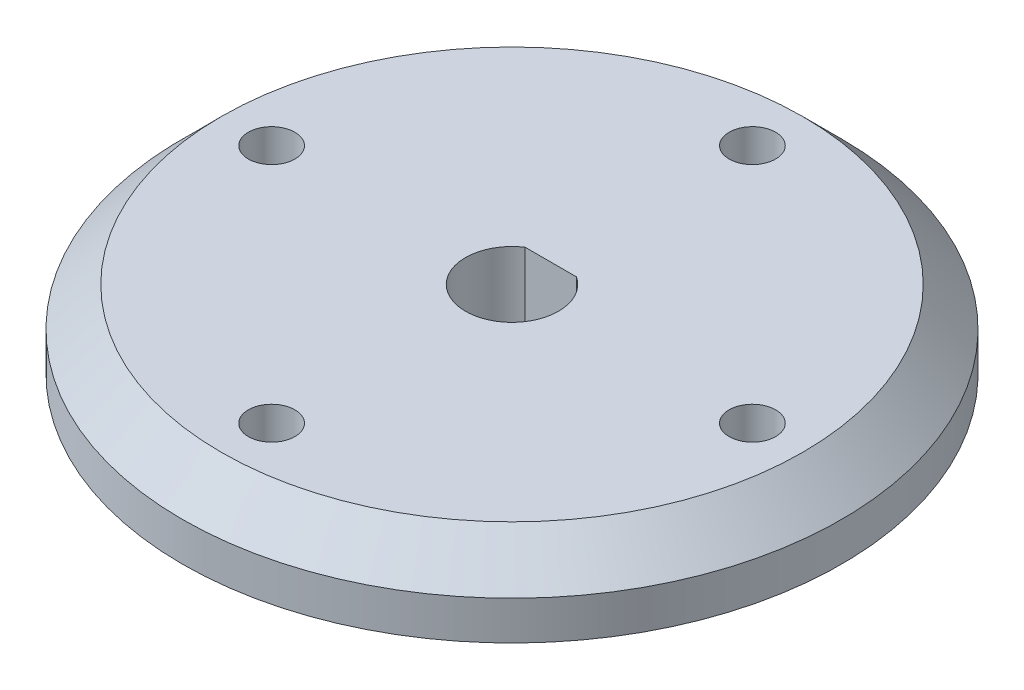
from build123d import *

# Parameters (mm, degrees)
SKETCH1_R           = 21.25
SKETCH1_R_2         = 1.5
BOSS_EXTRUDE1_DEPTH = 5
CHAMFER1_SIZE       = 2.5


with BuildPart() as part:
    # Sketch1 → Boss-Extrude1 (new body)
    with BuildSketch(Plane(origin=(0, 0, 0), x_dir=(1, 0, 0), z_dir=(0, 1, 0))):
        Circle(SKETCH1_R)
        with Locations((0, 15.5)):
            Circle(SKETCH1_R_2, mode=Mode.SUBTRACT)
        with Locations((15.5, 0)):
            Circle(SKETCH1_R_2, mode=Mode.SUBTRACT)
        with Locations((0, -15.5)):
            Circle(SKETCH1_R_2, mode=Mode.SUBTRACT)
        with Locations((-15.5, 0)):
            Circle(SKETCH1_R_2, mode=Mode.SUBTRACT)
        with BuildLine():
            Line((-1.658312395, 2.5), (1.658312395, 2.5))
            ThreePointArc((1.658312395, 2.5), (0, -3), (-1.658312395, 2.5))
        make_face(mode=Mode.SUBTRACT)
    extrude(amount=BOSS_EXTRUDE1_DEPTH)

    # Chamfer1
    chamfer1_edges = [part.edges().sort_by_distance(p)[0] for p in [
        (-21.25, 5, 0),
    ]]
    chamfer(chamfer1_edges, length=CHAMFER1_SIZE)


solid = part.part
